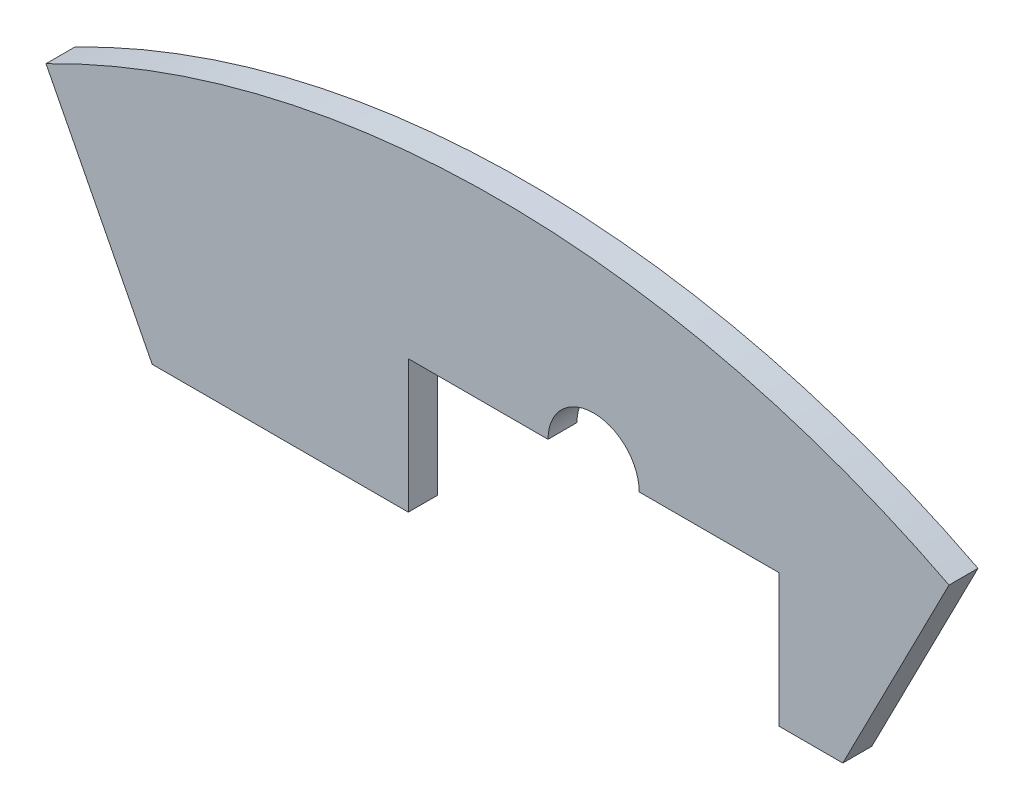
from build123d import *

# Parameters (mm, degrees)
BOSS_EXTRUDE1_DEPTH = 3.175


with BuildPart() as part:
    # Sketch1 → Boss-Extrude1 (new body)
    with BuildSketch(Plane.XY):
        with BuildLine():
            Line((-49.493260593, 96.579937313), (-37.85, 73.859563575))
            Line((-37.85, 73.859563575), (-9.78, 73.859563575))
            Line((-9.78, 73.859563575), (-9.78, 88.432328887))
            Line((-9.78, 88.432328887), (5.535, 88.432328887))
            ThreePointArc((5.535, 88.432328887), (10.535, 93.432328887), (15.535, 88.432328887))
            Line((15.535, 88.432328887), (30.85, 88.432328887))
            Line((30.85, 88.432328887), (30.85, 73.859563575))
            Line((30.85, 73.859563575), (37.85, 73.859563575))
            Line((37.85, 73.859563575), (49.493260593, 96.579937313))
            ThreePointArc((49.493260593, 96.579937313), (0, 108.523117977), (-49.493260593, 96.579937313))
        make_face()
    extrude(amount=BOSS_EXTRUDE1_DEPTH)


solid = part.part
